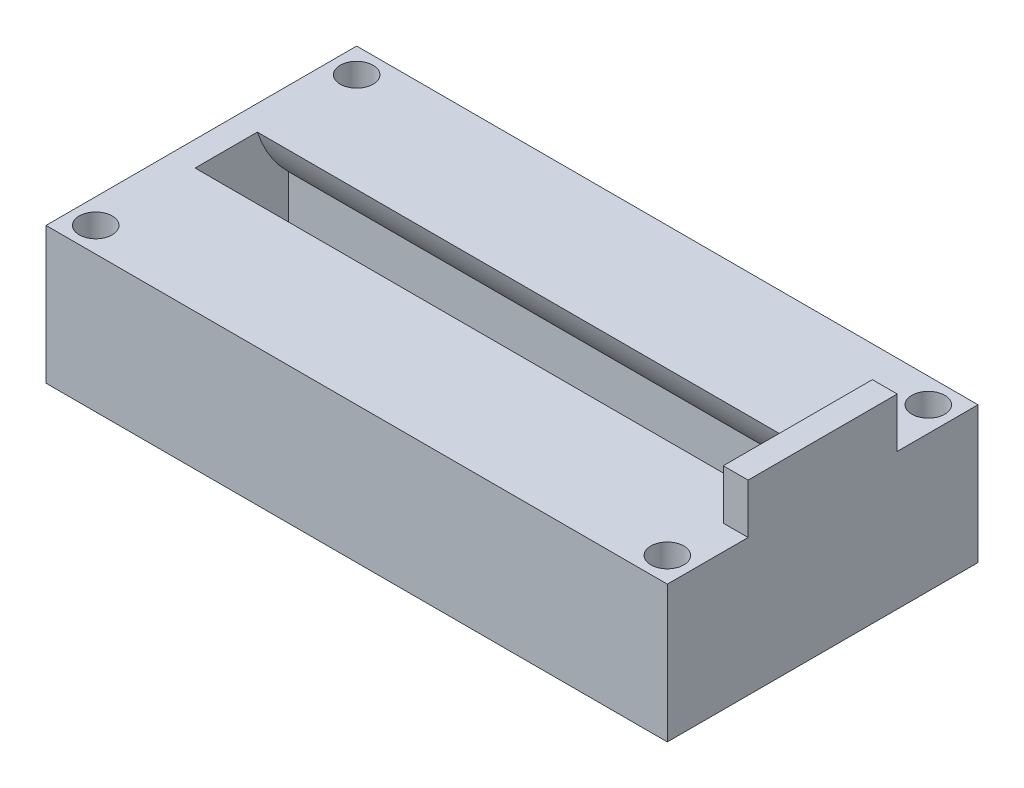
from build123d import *

# Parameters (mm, degrees)
SKETCH1_W           = 50
SKETCH1_H           = 25
SKETCH1_R           = 1.325
SKETCH1_W_2         = 46
SKETCH1_H_2         = 10
BOSS_EXTRUDE1_DEPTH = 7
SKETCH2_W           = 50
SKETCH2_H           = 25
SKETCH2_R           = 1.325
SKETCH2_W_2         = 46
SKETCH2_H_2         = 4
BOSS_EXTRUDE2_DEPTH = 4
SKETCH3_W           = 2
SKETCH3_H           = 12
BOSS_EXTRUDE3_DEPTH = 4
FILLET1_R           = 10
FILLET2_R           = 10
CUT_EXTRUDE1_DEPTH  = 4


with BuildPart() as part:
    # Sketch1 → Boss-Extrude1 (new body)
    with BuildSketch(Plane(origin=(0, 0, 0), x_dir=(1, 0, 0), z_dir=(0, 1, 0))):
        with Locations((25, 12.5)):
            Rectangle(SKETCH1_W, SKETCH1_H)
        with Locations(Location((2, 23, 0), (0, 0, 270))):
            Circle(SKETCH1_R, mode=Mode.SUBTRACT)
        with Locations(Location((48, 23, 0), (0, 0, 270))):
            Circle(SKETCH1_R, mode=Mode.SUBTRACT)
        with Locations(Location((48, 2, 0), (0, 0, 270))):
            Circle(SKETCH1_R, mode=Mode.SUBTRACT)
        with Locations(Location((2, 2, 0), (0, 0, 270))):
            Circle(SKETCH1_R, mode=Mode.SUBTRACT)
        with Locations((25, 12.5)):
            Rectangle(SKETCH1_W_2, SKETCH1_H_2, mode=Mode.SUBTRACT)
    extrude(amount=BOSS_EXTRUDE1_DEPTH)

    # Sketch2 → Boss-Extrude2 (add)
    with BuildSketch(Plane(origin=(0, 7, 0), x_dir=(1, 0, 0), z_dir=(0, 1, 0))):
        with Locations((25, 12.5)):
            Rectangle(SKETCH2_W, SKETCH2_H)
        with Locations(Location((2, 23, 0), (0, 0, 270))):
            Circle(SKETCH2_R, mode=Mode.SUBTRACT)
        with Locations(Location((48, 23, 0), (0, 0, 270))):
            Circle(SKETCH2_R, mode=Mode.SUBTRACT)
        with Locations(Location((48, 2, 0), (0, 0, 270))):
            Circle(SKETCH2_R, mode=Mode.SUBTRACT)
        with Locations(Location((2, 2, 0), (0, 0, 270))):
            Circle(SKETCH2_R, mode=Mode.SUBTRACT)
        with Locations((25, 12.5)):
            Rectangle(SKETCH2_W_2, SKETCH2_H_2, mode=Mode.SUBTRACT)
    extrude(amount=BOSS_EXTRUDE2_DEPTH)

    # Sketch3 → Boss-Extrude3 (add)
    with BuildSketch(Plane(origin=(0, 11, 0), x_dir=(1, 0, 0), z_dir=(0, 1, 0))):
        with Locations((49, 12.5)):
            Rectangle(SKETCH3_W, SKETCH3_H)
    extrude(amount=BOSS_EXTRUDE3_DEPTH)

    # Fillet1
    # the kernel refuses this fillet: 10 mm, written as the material it takes off along each edge
    with BuildSketch(Plane(origin=(2, 7, -14.5), x_dir=(0, 1, 0), z_dir=(1, 0, 0))) as fillet1_piece_1:
        with BuildLine():
            CenterArc((7.141428429, -10), FILLET1_R, 90, 45.572995999)
            Line((0, -3), (0, 0))
            Line((0, 0), (7.141428429, 0))
        make_face()
    extrude(amount=46, mode=Mode.SUBTRACT)

    # Fillet2
    # the kernel refuses this fillet: 10 mm, written as the material it takes off along each edge
    with BuildSketch(Plane(origin=(48, 7, -10.5), x_dir=(0, 1, 0), z_dir=(-1, 0, 0))) as fillet2_piece_1:
        with BuildLine():
            CenterArc((7.141428429, -10), FILLET2_R, 90, 45.572995999)
            Line((0, -3), (0, 0))
            Line((0, 0), (7.141428429, 0))
        make_face()
    extrude(amount=46, mode=Mode.SUBTRACT)

    # Sketch6 → Cut-Extrude1 (cut)
    with BuildSketch(Plane(origin=(0, 0, 0), x_dir=(-1, 0, 0), z_dir=(0, -1, 0))):
        with BuildLine():
            Line((-20.5, 19), (-29.5, 19))
            ThreePointArc((-29.5, 19), (-31.5, 21), (-29.5, 23))
            Line((-29.5, 23), (-20.5, 23))
            ThreePointArc((-20.5, 23), (-18.5, 21), (-20.5, 19))
        make_face()
    extrude(amount=-CUT_EXTRUDE1_DEPTH, mode=Mode.SUBTRACT)


solid = part.part
